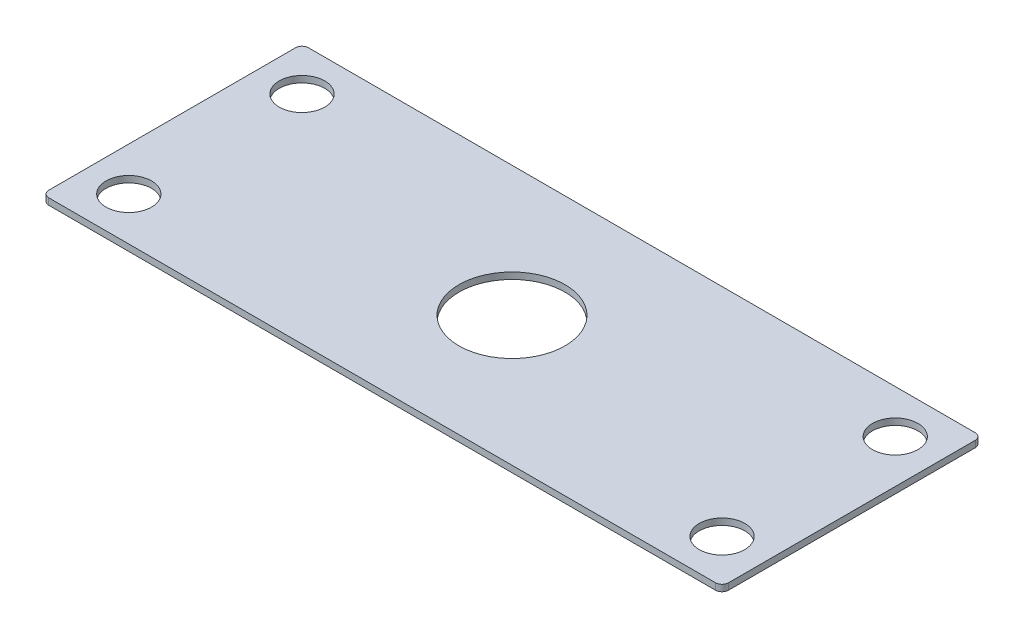
from build123d import *

# Parameters (mm, degrees)
SKETCH1_W           = 314
SKETCH1_H           = 120
SKETCH1_R           = 24.5
SKETCH1_R_2         = 10.5
BOSS_EXTRUDE1_DEPTH = 3
FILLET1_R           = 3


with BuildPart() as part:
    # Sketch1 → Boss-Extrude1 (new body)
    with BuildSketch(Plane(origin=(0, 0, 0), x_dir=(1, 0, 0), z_dir=(0, 1, 0))):
        Rectangle(SKETCH1_W, SKETCH1_H)
        with Locations(Location((0, 0, 0), (0, 0, 270))):
            Circle(SKETCH1_R, mode=Mode.SUBTRACT)
        with Locations(Location((-137, 40, 0), (0, 0, 270))):
            Circle(SKETCH1_R_2, mode=Mode.SUBTRACT)
        with Locations(Location((137, 40, 0), (0, 0, 90))):
            Circle(SKETCH1_R_2, mode=Mode.SUBTRACT)
        with Locations(Location((137, -40, 0), (0, 0, 270))):
            Circle(SKETCH1_R_2, mode=Mode.SUBTRACT)
        with Locations(Location((-137, -40, 0), (0, 0, 90))):
            Circle(SKETCH1_R_2, mode=Mode.SUBTRACT)
    extrude(amount=BOSS_EXTRUDE1_DEPTH)

    # Fillet1
    fillet1_edges = [part.edges().sort_by_distance(p)[0] for p in [
        (157, 1.5, -60),
        (157, 1.5, 60),
        (-157, 1.5, 60),
        (-157, 1.5, -60),
    ]]
    fillet(fillet1_edges, radius=FILLET1_R)


solid = part.part
